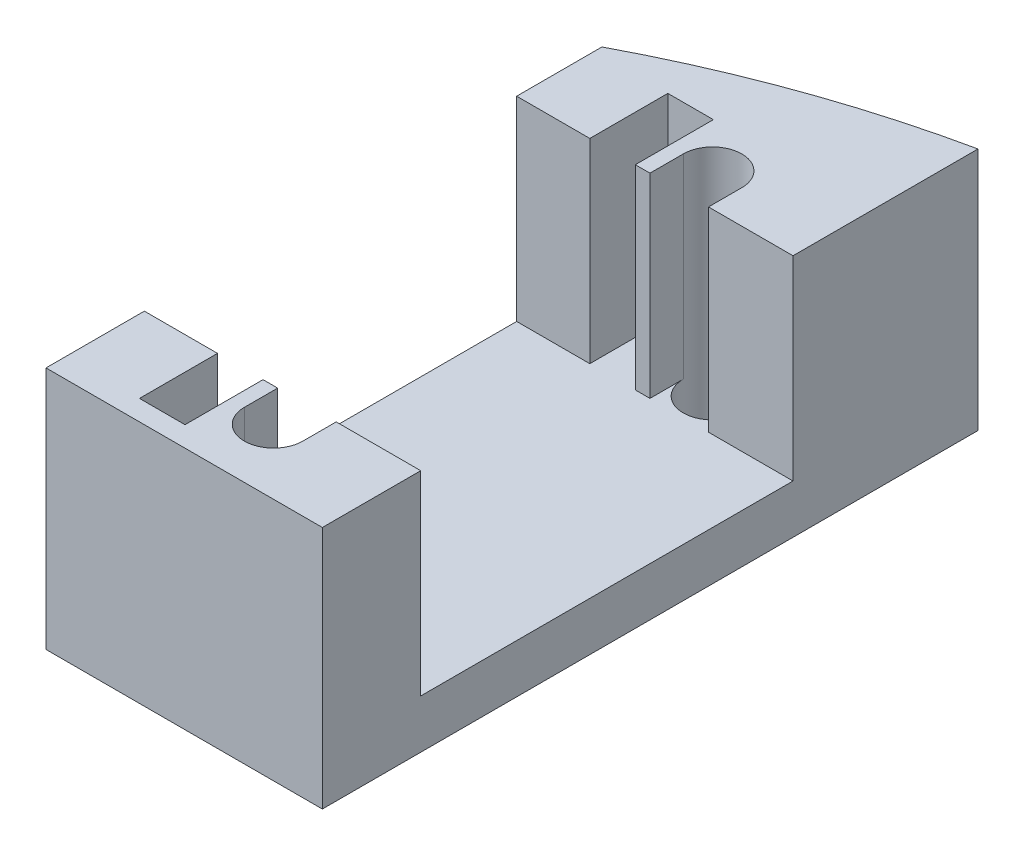
from build123d import *

# Parameters (mm, degrees)
SKETCH1_W            = 17
SKETCH1_H            = 35
BOSS_EXTRUDE1_DEPTH  = 3
M3_CLEARANCE_HOLE1_D = 3.6
SKETCH5_W            = 9.7
SKETCH5_H            = 6.05
BOSS_EXTRUDE2_DEPTH  = 12
CUT_EXTRUDE1_DEPTH   = 12
BOSS_EXTRUDE3_DEPTH  = 12
SKETCH8_W            = 17
SKETCH8_H            = 15
BOSS_EXTRUDE4_DEPTH  = 30
CUT_EXTRUDE2_START   = -15
CUT_EXTRUDE2_DEPTH   = 15


# Read off the part's stored shape, not the designer's step: Cut-Extrude2
with BuildPart() as part:
    # Sketch1 → Boss-Extrude1 (new body)
    with BuildSketch(Plane(origin=(0, 0, 0), x_dir=(1, 0, 0), z_dir=(0, 1, 0))):
        with Locations((-3.5, 0)):
            Rectangle(SKETCH1_W, SKETCH1_H)
    extrude(amount=BOSS_EXTRUDE1_DEPTH)

    # M3 Clearance Hole1 (through all)
    with Locations(Plane(origin=(0, 0, 0), x_dir=(-1, 0, 0), z_dir=(0, -1, 0))):
        with Locations((2, 13.5), (2, -13.5)):
            Hole(M3_CLEARANCE_HOLE1_D / 2)

    # Sketch5 → Boss-Extrude2 (add)
    with BuildSketch(Plane(origin=(0, 3, 0), x_dir=(1, 0, 0), z_dir=(0, 1, 0))):
        with Locations((0.15, -14.475)):
            Rectangle(SKETCH5_W, SKETCH5_H)
        with Locations((0.15, 14.475)):
            Rectangle(SKETCH5_W, SKETCH5_H)
    extrude(amount=BOSS_EXTRUDE2_DEPTH)

    # Sketch6 → Cut-Extrude1 (cut)
    with BuildSketch(Plane(origin=(0, 15, 0), x_dir=(1, 0, 0), z_dir=(0, 1, 0))):
        with BuildLine():
            Line((-3.8, -13.5), (-3.8, 13.5))
            ThreePointArc((-3.8, 13.5), (-2, 15.3), (-0.2, 13.5))
            Line((-0.2, 13.5), (-0.2, -13.5))
            ThreePointArc((-0.2, -13.5), (-2, -15.3), (-3.8, -13.5))
        make_face()
    extrude(amount=-CUT_EXTRUDE1_DEPTH, mode=Mode.SUBTRACT)

    # Sketch7 → Boss-Extrude3 (add)
    with BuildSketch(Plane(origin=(0, 3, 0), x_dir=(1, 0, 0), z_dir=(0, 1, 0))):
        Polygon((-12, -17.5), (-4.7, -17.5), (-4.7, -16.25), (-7.5, -16.25), (-7.5, -11.45), (-12, -11.45), align=None)
        Polygon((-12, 17.5), (-4.7, 17.5), (-4.7, 16.25), (-7.5, 16.25), (-7.5, 11.45), (-12, 11.45), align=None)
    extrude(amount=BOSS_EXTRUDE3_DEPTH)

    # Sketch8 → Boss-Extrude4 (add)
    with BuildSketch(Plane(origin=(0, 0, -17.5), x_dir=(-1, 0, 0), z_dir=(0, 0, -1))):
        with Locations((3.5, 7.5)):
            Rectangle(SKETCH8_W, SKETCH8_H)
    extrude(amount=BOSS_EXTRUDE4_DEPTH)

    # Cut-Extrude2 outline → Cut-Extrude2 (cut)
    with BuildSketch(Plane(origin=(0, 15, 0), x_dir=(1, 0, 0), z_dir=(0, 1, 0)).offset(CUT_EXTRUDE2_START)):
        with BuildLine():
            ThreePointArc((-12, 16.695382119), (-3.71171241, 20.348605395), (5, 22.828084846))
            Line((5, 22.828084846), (5, 47.5))
            Line((5, 47.5), (-12, 47.5))
            Line((-12, 47.5), (-12, 16.695382119))
        make_face()
    extrude(amount=CUT_EXTRUDE2_DEPTH, mode=Mode.SUBTRACT)


solid = part.part
